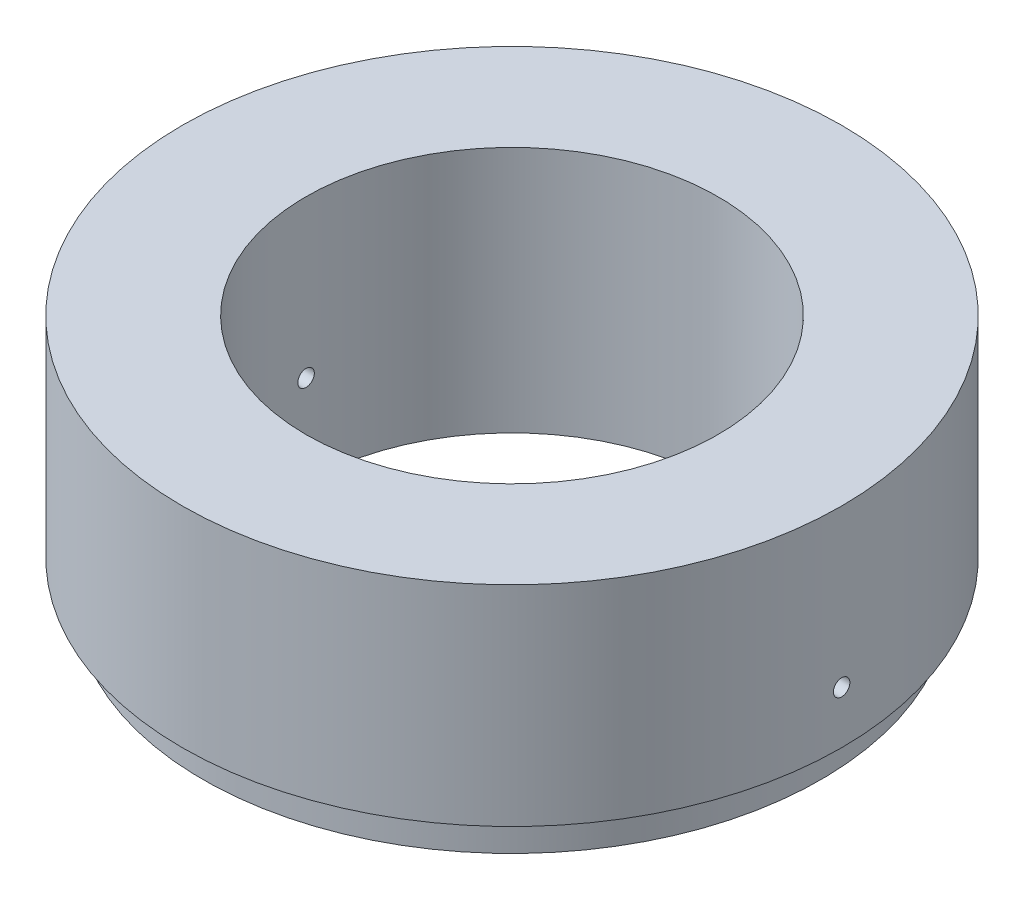
from build123d import *

# Parameters (mm, degrees)
SKETCH1_R               = 40
SKETCH1_R_2             = 25
BOSS_EXTRUDE1_DEPTH     = 30
SKETCH2_R               = 40
SKETCH2_R_2             = 37.5
CUT_EXTRUDE1_DEPTH      = 4.6
CUT_EXTRUDE2_DEPTH      = 65.031242374
CUT_EXTRUDE2_DEPTH_BACK = 65.031242374
SKETCH3_R               = 1


with BuildPart() as part:
    # Sketch1 → Boss-Extrude1 (new body)
    with BuildSketch(Plane(origin=(0, 0, 0), x_dir=(1, 0, 0), z_dir=(0, 1, 0))):
        Circle(SKETCH1_R)
        Circle(SKETCH1_R_2, mode=Mode.SUBTRACT)
    extrude(amount=BOSS_EXTRUDE1_DEPTH)

    # Sketch2 → Cut-Extrude1 (cut)
    with BuildSketch(Plane.XZ):
        Circle(SKETCH2_R)
        Circle(SKETCH2_R_2, mode=Mode.SUBTRACT)
    extrude(amount=-CUT_EXTRUDE1_DEPTH, mode=Mode.SUBTRACT)

    # Sketch3 → Cut-Extrude2 (cut, two sides: drawn at the far end of the back side and taken through both)
    with BuildSketch(Plane(origin=(0, 0, 0), x_dir=(0, 0, -1), z_dir=(1, 0, 0)).offset(-CUT_EXTRUDE2_DEPTH_BACK)):
        with Locations((0, 10.95)):
            Circle(SKETCH3_R)
    extrude(amount=CUT_EXTRUDE2_DEPTH + CUT_EXTRUDE2_DEPTH_BACK, mode=Mode.SUBTRACT)


solid = part.part
